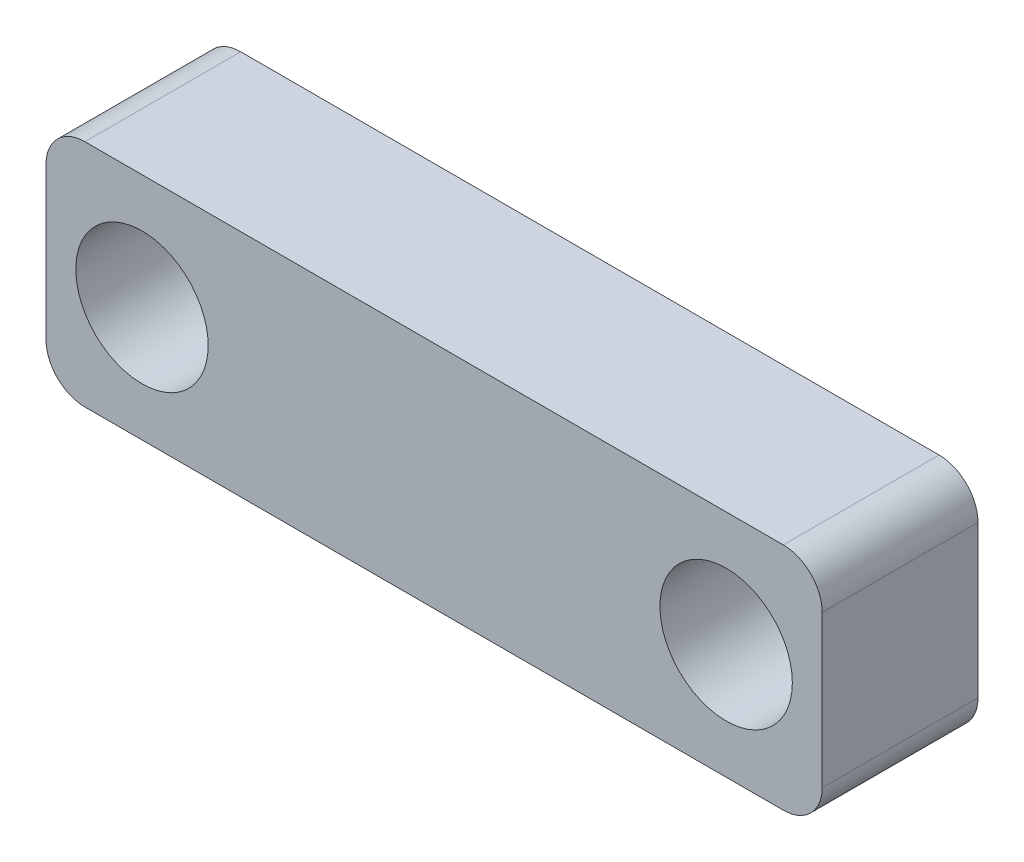
from build123d import *

# Parameters (mm, degrees)
SKETCH2_W                = 19.932631385
SKETCH2_H                = 5.9
BOSS_EXTRUDE1_DEPTH      = 4
FILLET1_R                = 1
M3_CLEARANCE_HOLE1_D     = 3.4
M3_CLEARANCE_HOLE1_DEPTH = 16.5
M3_CLEARANCE_HOLE1_TIP   = 1.021463052


with BuildPart() as part:
    # Sketch2 → Boss-Extrude1 (new body)
    with BuildSketch(Plane.XY.offset(133.365661293)):
        with Locations((-21.255805031, 37.989811256)):
            Rectangle(SKETCH2_W, SKETCH2_H)
    extrude(amount=BOSS_EXTRUDE1_DEPTH)

    # Fillet1
    fillet1_edges = [part.edges().sort_by_distance(p)[0] for p in [
        (-11.289489338, 35.039811256, 135.365661293),
        (-11.289489338, 40.939811256, 135.365661293),
        (-31.222120723, 35.039811256, 135.365661293),
        (-31.222120723, 40.939811256, 135.365661293),
    ]]
    fillet(fillet1_edges, radius=FILLET1_R)

    # M3 Clearance Hole1
    with Locations(Plane.XY.offset(137.365661293)):
        with Locations((-28.757120723, 37.989811256), (-13.757120723, 37.989811256)):
            Hole(M3_CLEARANCE_HOLE1_D / 2, depth=M3_CLEARANCE_HOLE1_DEPTH)
            with Locations((0, 0, -(M3_CLEARANCE_HOLE1_DEPTH + M3_CLEARANCE_HOLE1_TIP / 2))):  # 118° drill point
                Cone(0, M3_CLEARANCE_HOLE1_D / 2, M3_CLEARANCE_HOLE1_TIP, mode=Mode.SUBTRACT)


solid = part.part
